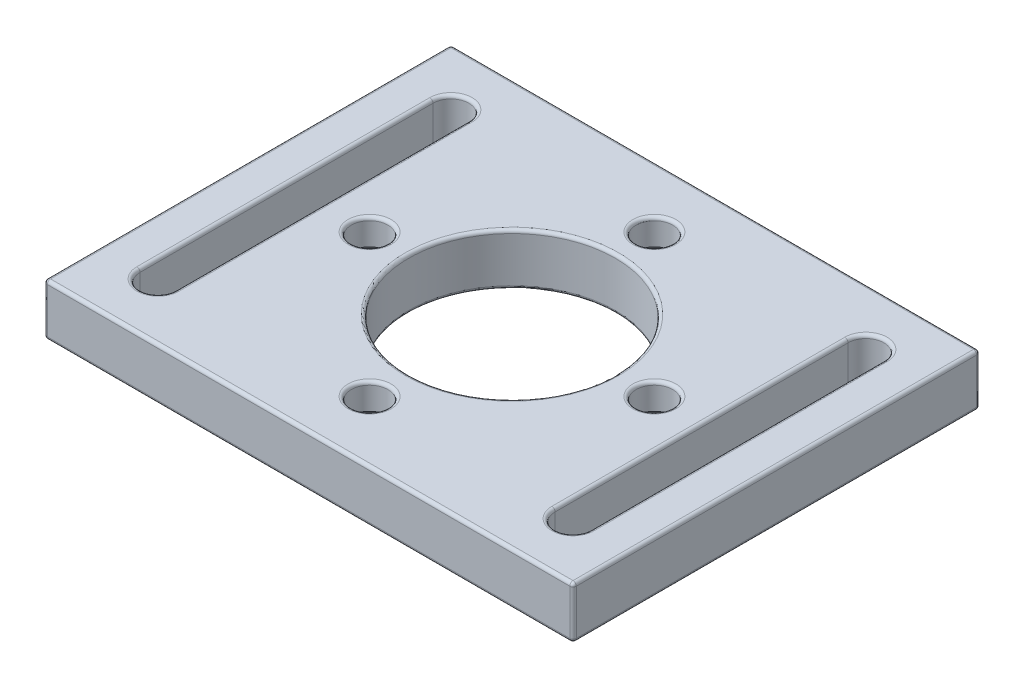
from build123d import *

# Parameters (mm, degrees)
SKETCH2_W           = 65
SKETCH2_H           = 50
SKETCH2_R           = 12.7
BOSS_EXTRUDE1_DEPTH = 6.35
CIRPATTERN1_COUNT   = 4
FILLET1_R           = 0.4


with BuildPart() as part:
    # Sketch2 → Boss-Extrude1 (new body)
    with BuildSketch(Plane(origin=(0, 0, 0), x_dir=(1, 0, 0), z_dir=(0, 1, 0))):
        Rectangle(SKETCH2_W, SKETCH2_H)
        with Locations(Location((0, 0, 0), (0, 0, 270))):
            Circle(SKETCH2_R, mode=Mode.SUBTRACT)
        with BuildLine():
            Line((-23.3, 18), (-23.3, -18))
            ThreePointArc((-23.3, -18), (-25.5, -20.2), (-27.7, -18))
            Line((-27.7, -18), (-27.7, 18))
            ThreePointArc((-27.7, 18), (-25.5, 20.2), (-23.3, 18))
        make_face(mode=Mode.SUBTRACT)
        with BuildLine():
            Line((23.3, 18), (23.3, -18))
            ThreePointArc((23.3, -18), (25.5, -20.2), (27.7, -18))
            Line((27.7, -18), (27.7, 18))
            ThreePointArc((27.7, 18), (25.5, 20.2), (23.3, 18))
        make_face(mode=Mode.SUBTRACT)
    extrude(amount=BOSS_EXTRUDE1_DEPTH)

    # Sketch3 → Cut-Revolve1 (revolve, cut)
    with BuildSketch(Plane(origin=(0, 0, 0), x_dir=(0, 0, -1), z_dir=(1, 0, 0)), mode=Mode.PRIVATE) as cut_revolve1_sk:
        Polygon((12.8, 0), (17.5, 0), (17.5, 6.35), (15.25, 6.35), (15.25, 3.175), align=None)
    cut_revolve1 = revolve(cut_revolve1_sk.sketch.rotate(Axis((0, 0, -17.5), (0, 1, 0)), 180), axis=Axis((0, 0, -17.5), (0, 1, 0)), mode=Mode.SUBTRACT)

    # CirPattern1: Cut-Revolve1 ×4 about axis
    cirpattern1_axis = Axis((0, 0, 0), (0, 1, 0))
    for i in range(1, CIRPATTERN1_COUNT):
        add(cut_revolve1.rotate(cirpattern1_axis, i * 360 / CIRPATTERN1_COUNT), mode=Mode.SUBTRACT)

    # Fillet1
    # the kernel refuses this fillet: 0.4 mm, written as the material it takes off along each edge
    with BuildSketch(Plane(origin=(32.1, 5.95, -24.6), x_dir=(0, 1, 0), z_dir=(1, 0, 0))) as fillet1_piece_1_section:
        Polygon((0, 0), (FILLET1_R, 0), (FILLET1_R, -FILLET1_R), (0, -FILLET1_R), align=None)
    fillet1_piece_1 = extrude(amount=FILLET1_R, mode=Mode.PRIVATE)
    fillet1_piece_1 = fillet1_piece_1 - Plane(origin=(32.1, 5.95, -24.6), x_dir=(0, -0.7071067811865475, 0.7071067811865475), z_dir=(1, 0, 0)) * Sphere(FILLET1_R, mode=Mode.PRIVATE)
    add(fillet1_piece_1, mode=Mode.SUBTRACT)
    with BuildSketch(Plane(origin=(32.1, 5.95, 24.6), x_dir=(1, 0, 0), z_dir=(0, 0, 1))) as fillet1_piece_2_section:
        Polygon((0, 0), (FILLET1_R, 0), (FILLET1_R, FILLET1_R), (0, FILLET1_R), align=None)
    fillet1_piece_2 = extrude(amount=FILLET1_R, mode=Mode.PRIVATE)
    fillet1_piece_2 = fillet1_piece_2 - Plane(origin=(32.1, 5.95, 24.6), x_dir=(-0.7071067811865475, -0.7071067811865475, 0), z_dir=(0, 0, 1)) * Sphere(FILLET1_R, mode=Mode.PRIVATE)
    add(fillet1_piece_2, mode=Mode.SUBTRACT)
    with BuildSketch(Plane(origin=(-32.1, 5.95, -24.6), x_dir=(0, 1, 0), z_dir=(-1, 0, 0))) as fillet1_piece_3_section:
        Polygon((0, 0), (FILLET1_R, 0), (FILLET1_R, FILLET1_R), (0, FILLET1_R), align=None)
    fillet1_piece_3 = extrude(amount=FILLET1_R, mode=Mode.PRIVATE)
    fillet1_piece_3 = fillet1_piece_3 - Plane(origin=(-32.1, 5.95, -24.6), x_dir=(0, -0.7071067811865475, 0.7071067811865475), z_dir=(-1, 0, 0)) * Sphere(FILLET1_R, mode=Mode.PRIVATE)
    add(fillet1_piece_3, mode=Mode.SUBTRACT)
    with BuildSketch(Plane(origin=(-32.1, 5.95, 24.6), x_dir=(-1, 0, 0), z_dir=(0, 0, 1))) as fillet1_piece_4_section:
        Polygon((0, 0), (FILLET1_R, 0), (FILLET1_R, -FILLET1_R), (0, -FILLET1_R), align=None)
    fillet1_piece_4 = extrude(amount=FILLET1_R, mode=Mode.PRIVATE)
    fillet1_piece_4 = fillet1_piece_4 - Plane(origin=(-32.1, 5.95, 24.6), x_dir=(0.7071067811865475, -0.7071067811865475, 0), z_dir=(0, 0, 1)) * Sphere(FILLET1_R, mode=Mode.PRIVATE)
    add(fillet1_piece_4, mode=Mode.SUBTRACT)
    with BuildSketch(Plane(origin=(-32.1, 0.4, -24.6), x_dir=(0, -1, 0), z_dir=(-1, 0, 0))) as fillet1_piece_5_section:
        Polygon((0, 0), (FILLET1_R, 0), (FILLET1_R, -FILLET1_R), (0, -FILLET1_R), align=None)
    fillet1_piece_5 = extrude(amount=FILLET1_R, mode=Mode.PRIVATE)
    fillet1_piece_5 = fillet1_piece_5 - Plane(origin=(-32.1, 0.4, -24.6), x_dir=(0, 0.7071067811865475, 0.7071067811865475), z_dir=(-1, 0, 0)) * Sphere(FILLET1_R, mode=Mode.PRIVATE)
    add(fillet1_piece_5, mode=Mode.SUBTRACT)
    with BuildSketch(Plane(origin=(32.1, 0.4, -24.6), x_dir=(0, -1, 0), z_dir=(1, 0, 0))) as fillet1_piece_6_section:
        Polygon((0, 0), (FILLET1_R, 0), (FILLET1_R, FILLET1_R), (0, FILLET1_R), align=None)
    fillet1_piece_6 = extrude(amount=FILLET1_R, mode=Mode.PRIVATE)
    fillet1_piece_6 = fillet1_piece_6 - Plane(origin=(32.1, 0.4, -24.6), x_dir=(0, 0.7071067811865475, 0.7071067811865475), z_dir=(1, 0, 0)) * Sphere(FILLET1_R, mode=Mode.PRIVATE)
    add(fillet1_piece_6, mode=Mode.SUBTRACT)
    with BuildSketch(Plane(origin=(32.1, 0.4, 24.6), x_dir=(1, 0, 0), z_dir=(0, 0, 1))) as fillet1_piece_7_section:
        Polygon((0, 0), (FILLET1_R, 0), (FILLET1_R, -FILLET1_R), (0, -FILLET1_R), align=None)
    fillet1_piece_7 = extrude(amount=FILLET1_R, mode=Mode.PRIVATE)
    fillet1_piece_7 = fillet1_piece_7 - Plane(origin=(32.1, 0.4, 24.6), x_dir=(-0.7071067811865475, 0.7071067811865475, 0), z_dir=(0, 0, 1)) * Sphere(FILLET1_R, mode=Mode.PRIVATE)
    add(fillet1_piece_7, mode=Mode.SUBTRACT)
    with BuildSketch(Plane(origin=(-32.1, 0.4, 24.6), x_dir=(-1, 0, 0), z_dir=(0, 0, 1))) as fillet1_piece_8_section:
        Polygon((0, 0), (FILLET1_R, 0), (FILLET1_R, FILLET1_R), (0, FILLET1_R), align=None)
    fillet1_piece_8 = extrude(amount=FILLET1_R, mode=Mode.PRIVATE)
    fillet1_piece_8 = fillet1_piece_8 - Plane(origin=(-32.1, 0.4, 24.6), x_dir=(0.7071067811865475, 0.7071067811865475, 0), z_dir=(0, 0, 1)) * Sphere(FILLET1_R, mode=Mode.PRIVATE)
    add(fillet1_piece_8, mode=Mode.SUBTRACT)
    with BuildSketch(Plane(origin=(32.5, 6.35, -24.6), x_dir=(0, -1, 0), z_dir=(0, 0, 1)), Plane(origin=(-32.5, 6.35, 24.6), x_dir=(0, -1, 0), z_dir=(0, 0, -1))) as fillet1_piece_9:
        with BuildLine():
            CenterArc((FILLET1_R, -FILLET1_R), FILLET1_R, 90, 90)
            Line((0, -FILLET1_R), (0, 0))
            Line((0, 0), (FILLET1_R, 0))
        make_face()
    extrude(amount=49.2, mode=Mode.SUBTRACT)
    with BuildSketch(Plane(origin=(-32.1, 6.35, -25), x_dir=(0, 0, 1), z_dir=(1, 0, 0)), Plane(origin=(32.1, 0, 25), x_dir=(0, 1, 0), z_dir=(-1, 0, 0))) as fillet1_piece_10:
        with BuildLine():
            CenterArc((FILLET1_R, FILLET1_R), FILLET1_R, 180, 90)
            Line((0, FILLET1_R), (0, 0))
            Line((0, 0), (FILLET1_R, 0))
        make_face()
    extrude(amount=64.2, mode=Mode.SUBTRACT)
    with BuildSketch(Plane(origin=(-25.5, 0, -18), x_dir=(-1, 0, 0), z_dir=(0, 0, 1))) as fillet1_piece_11:
        with BuildLine():
            CenterArc((2.2 + FILLET1_R, -FILLET1_R), FILLET1_R, 90, 90)
            Line((2.2, -FILLET1_R), (2.2, 0))
            Line((2.2, 0), (2.2 + FILLET1_R, 0))
        make_face()
    revolve(axis=Axis((-25.5, 0, -18), (0, -1, 0)), revolution_arc=180, mode=Mode.SUBTRACT)
    with BuildSketch(Plane(origin=(-27.7, 0, 18), x_dir=(-1, 0, 0), z_dir=(0, 0, -1)), Plane(origin=(-23.3, 0, -18), x_dir=(1, 0, 0), z_dir=(0, 0, 1)), Plane(origin=(23.3, 6.35, -18), x_dir=(-1, 0, 0), z_dir=(0, 0, 1)), Plane(origin=(27.7, 6.35, 18), x_dir=(1, 0, 0), z_dir=(0, 0, -1))) as fillet1_piece_12:
        with BuildLine():
            CenterArc((FILLET1_R, FILLET1_R), FILLET1_R, 180, 90)
            Line((0, FILLET1_R), (0, 0))
            Line((0, 0), (FILLET1_R, 0))
        make_face()
    extrude(amount=36, mode=Mode.SUBTRACT)
    with BuildSketch(Plane(origin=(-25.5, 0, 18), x_dir=(1, 0, 0), z_dir=(0, 0, -1))) as fillet1_piece_13:
        with BuildLine():
            CenterArc((2.2 + FILLET1_R, -FILLET1_R), FILLET1_R, 90, 90)
            Line((2.2, -FILLET1_R), (2.2, 0))
            Line((2.2, 0), (2.2 + FILLET1_R, 0))
        make_face()
    revolve(axis=Axis((-25.5, 0, 18), (0, -1, 0)), revolution_arc=180, mode=Mode.SUBTRACT)
    with BuildSketch(Plane(origin=(-25.5, 6.35, -18), x_dir=(-1, 0, 0), z_dir=(0, 0, 1))) as fillet1_piece_14:
        with BuildLine():
            CenterArc((2.2 + FILLET1_R, FILLET1_R), FILLET1_R, 180, 90)
            Line((2.2, FILLET1_R), (2.2, 0))
            Line((2.2, 0), (2.2 + FILLET1_R, 0))
        make_face()
    revolve(axis=Axis((-25.5, 6.35, -18), (0, -1, 0)), revolution_arc=180, mode=Mode.SUBTRACT)
    with BuildSketch(Plane(origin=(-27.7, 6.35, 18), x_dir=(-1, 0, 0), z_dir=(0, 0, -1)), Plane(origin=(-23.3, 6.35, -18), x_dir=(1, 0, 0), z_dir=(0, 0, 1)), Plane(origin=(23.3, 0, -18), x_dir=(-1, 0, 0), z_dir=(0, 0, 1)), Plane(origin=(27.7, 0, 18), x_dir=(1, 0, 0), z_dir=(0, 0, -1))) as fillet1_piece_15:
        with BuildLine():
            CenterArc((FILLET1_R, -FILLET1_R), FILLET1_R, 90, 90)
            Line((0, -FILLET1_R), (0, 0))
            Line((0, 0), (FILLET1_R, 0))
        make_face()
    extrude(amount=36, mode=Mode.SUBTRACT)
    with BuildSketch(Plane(origin=(-25.5, 6.35, 18), x_dir=(1, 0, 0), z_dir=(0, 0, -1))) as fillet1_piece_16:
        with BuildLine():
            CenterArc((2.2 + FILLET1_R, FILLET1_R), FILLET1_R, 180, 90)
            Line((2.2, FILLET1_R), (2.2, 0))
            Line((2.2, 0), (2.2 + FILLET1_R, 0))
        make_face()
    revolve(axis=Axis((-25.5, 6.35, 18), (0, -1, 0)), revolution_arc=180, mode=Mode.SUBTRACT)
    with BuildSketch(Plane(origin=(0, 0, 0), x_dir=(0, 0, 1), z_dir=(-1, 0, 0))) as fillet1_piece_17:
        with BuildLine():
            CenterArc((12.7 + FILLET1_R, FILLET1_R), FILLET1_R, 180, 90)
            Line((12.7, FILLET1_R), (12.7, 0))
            Line((12.7, 0), (12.7 + FILLET1_R, 0))
        make_face()
    revolve(axis=Axis((0, 0, 0), (0, 1, 0)), mode=Mode.SUBTRACT)
    with BuildSketch(Plane(origin=(0, 6.35, 0), x_dir=(0, 0, 1), z_dir=(-1, 0, 0))) as fillet1_piece_18:
        with BuildLine():
            CenterArc((12.7 + FILLET1_R, -FILLET1_R), FILLET1_R, 90, 90)
            Line((12.7, -FILLET1_R), (12.7, 0))
            Line((12.7, 0), (12.7 + FILLET1_R, 0))
        make_face()
    revolve(axis=Axis((0, 6.35, 0), (0, 1, 0)), mode=Mode.SUBTRACT)
    with BuildSketch(Plane(origin=(25.5, 0, -18), x_dir=(1, 0, 0), z_dir=(0, 0, 1))) as fillet1_piece_19:
        with BuildLine():
            CenterArc((2.2 + FILLET1_R, FILLET1_R), FILLET1_R, 180, 90)
            Line((2.2, FILLET1_R), (2.2, 0))
            Line((2.2, 0), (2.2 + FILLET1_R, 0))
        make_face()
    revolve(axis=Axis((25.5, 0, -18), (0, 1, 0)), revolution_arc=180, mode=Mode.SUBTRACT)
    with BuildSketch(Plane(origin=(25.5, 0, 18), x_dir=(-1, 0, 0), z_dir=(0, 0, -1))) as fillet1_piece_20:
        with BuildLine():
            CenterArc((2.2 + FILLET1_R, FILLET1_R), FILLET1_R, 180, 90)
            Line((2.2, FILLET1_R), (2.2, 0))
            Line((2.2, 0), (2.2 + FILLET1_R, 0))
        make_face()
    revolve(axis=Axis((25.5, 0, 18), (0, 1, 0)), revolution_arc=180, mode=Mode.SUBTRACT)
    with BuildSketch(Plane(origin=(25.5, 6.35, -18), x_dir=(1, 0, 0), z_dir=(0, 0, 1))) as fillet1_piece_21:
        with BuildLine():
            CenterArc((2.2 + FILLET1_R, -FILLET1_R), FILLET1_R, 90, 90)
            Line((2.2, -FILLET1_R), (2.2, 0))
            Line((2.2, 0), (2.2 + FILLET1_R, 0))
        make_face()
    revolve(axis=Axis((25.5, 6.35, -18), (0, 1, 0)), revolution_arc=180, mode=Mode.SUBTRACT)
    with BuildSketch(Plane(origin=(25.5, 6.35, 18), x_dir=(-1, 0, 0), z_dir=(0, 0, -1))) as fillet1_piece_22:
        with BuildLine():
            CenterArc((2.2 + FILLET1_R, -FILLET1_R), FILLET1_R, 90, 90)
            Line((2.2, -FILLET1_R), (2.2, 0))
            Line((2.2, 0), (2.2 + FILLET1_R, 0))
        make_face()
    revolve(axis=Axis((25.5, 6.35, 18), (0, 1, 0)), revolution_arc=180, mode=Mode.SUBTRACT)
    with BuildSketch(Plane(origin=(-32.1, 0, -25), x_dir=(0, 0, 1), z_dir=(1, 0, 0)), Plane(origin=(32.1, 6.35, 25), x_dir=(0, -1, 0), z_dir=(-1, 0, 0))) as fillet1_piece_23:
        with BuildLine():
            CenterArc((FILLET1_R, -FILLET1_R), FILLET1_R, 90, 90)
            Line((0, -FILLET1_R), (0, 0))
            Line((0, 0), (FILLET1_R, 0))
        make_face()
    extrude(amount=64.2, mode=Mode.SUBTRACT)
    with BuildSketch(Plane(origin=(0, 6.35, -17.5), x_dir=(0, 0, -1), z_dir=(1, 0, 0))) as fillet1_piece_24:
        with BuildLine():
            CenterArc((2.25 + FILLET1_R, -FILLET1_R), FILLET1_R, 90, 90)
            Line((2.25, -FILLET1_R), (2.25, 0))
            Line((2.25, 0), (2.25 + FILLET1_R, 0))
        make_face()
    revolve(axis=Axis((0, 6.35, -17.5), (0, 1, 0)), mode=Mode.SUBTRACT)
    with BuildSketch(Plane(origin=(32.5, 0, -24.6), x_dir=(0, 1, 0), z_dir=(0, 0, 1)), Plane(origin=(-32.5, 0, 24.6), x_dir=(0, 1, 0), z_dir=(0, 0, -1))) as fillet1_piece_25:
        with BuildLine():
            CenterArc((FILLET1_R, FILLET1_R), FILLET1_R, 180, 90)
            Line((0, FILLET1_R), (0, 0))
            Line((0, 0), (FILLET1_R, 0))
        make_face()
    extrude(amount=49.2, mode=Mode.SUBTRACT)
    with BuildSketch(Plane(origin=(-17.5, 6.35, 0), x_dir=(-1, 0, 0), z_dir=(0, 0, -1))) as fillet1_piece_26:
        with BuildLine():
            CenterArc((2.25 + FILLET1_R, -FILLET1_R), FILLET1_R, 90, 90)
            Line((2.25, -FILLET1_R), (2.25, 0))
            Line((2.25, 0), (2.25 + FILLET1_R, 0))
        make_face()
    revolve(axis=Axis((-17.5, 6.35, 0), (0, 1, 0)), mode=Mode.SUBTRACT)
    with BuildSketch(Plane(origin=(0, 6.35, 17.5), x_dir=(0, 0, 1), z_dir=(-1, 0, 0))) as fillet1_piece_27:
        with BuildLine():
            CenterArc((2.25 + FILLET1_R, -FILLET1_R), FILLET1_R, 90, 90)
            Line((2.25, -FILLET1_R), (2.25, 0))
            Line((2.25, 0), (2.25 + FILLET1_R, 0))
        make_face()
    revolve(axis=Axis((0, 6.35, 17.5), (0, 1, 0)), mode=Mode.SUBTRACT)
    with BuildSketch(Plane(origin=(17.5, 6.35, 0), x_dir=(1, 0, 0), z_dir=(0, 0, 1))) as fillet1_piece_28:
        with BuildLine():
            CenterArc((2.25 + FILLET1_R, -FILLET1_R), FILLET1_R, 90, 90)
            Line((2.25, -FILLET1_R), (2.25, 0))
            Line((2.25, 0), (2.25 + FILLET1_R, 0))
        make_face()
    revolve(axis=Axis((17.5, 6.35, 0), (0, 1, 0)), mode=Mode.SUBTRACT)
    with BuildSketch(Plane(origin=(-32.5, 0.4, -25), x_dir=(0, 0, 1), z_dir=(0, 1, 0)), Plane(origin=(-32.5, 0.4, 25), x_dir=(1, 0, 0), z_dir=(0, 1, 0))) as fillet1_piece_29:
        with BuildLine():
            CenterArc((FILLET1_R, FILLET1_R), FILLET1_R, 180, 90)
            Line((0, FILLET1_R), (0, 0))
            Line((0, 0), (FILLET1_R, 0))
        make_face()
    extrude(amount=5.55, mode=Mode.SUBTRACT)
    with BuildSketch(Plane(origin=(32.5, 0.4, -25), x_dir=(0, 0, 1), z_dir=(0, 1, 0)), Plane(origin=(32.5, 0.4, 25), x_dir=(-1, 0, 0), z_dir=(0, 1, 0))) as fillet1_piece_30:
        with BuildLine():
            CenterArc((FILLET1_R, -FILLET1_R), FILLET1_R, 90, 90)
            Line((0, -FILLET1_R), (0, 0))
            Line((0, 0), (FILLET1_R, 0))
        make_face()
    extrude(amount=5.55, mode=Mode.SUBTRACT)


solid = part.part
